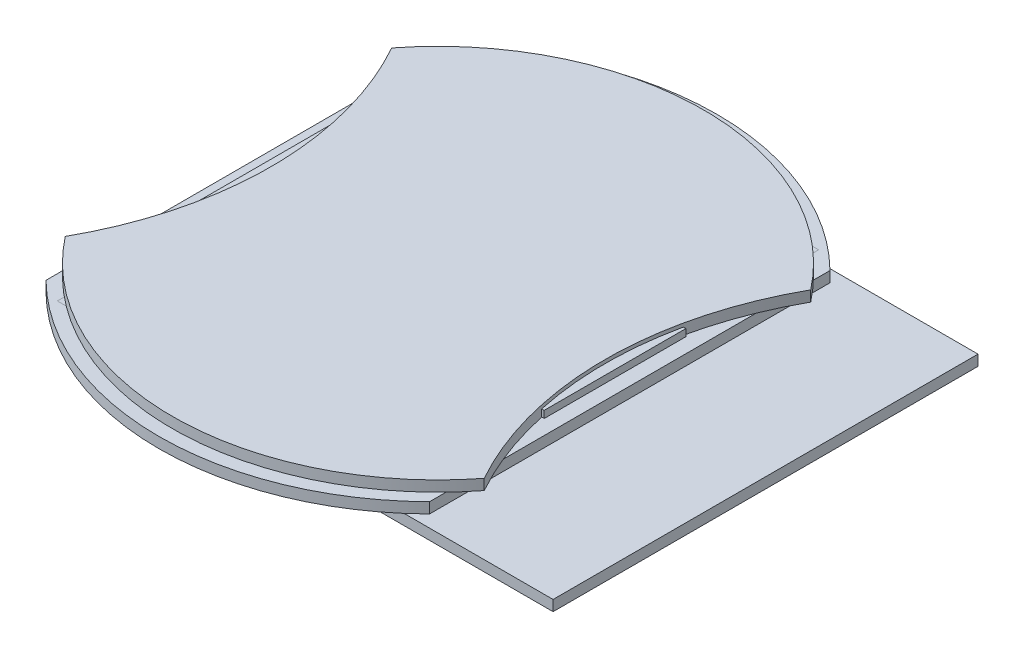
from build123d import *

# Parameters (mm, degrees)
SKETCH1_W                   = 140
SKETCH1_H                   = 120
COMPACT_DEPTH               = 3
SKETCH4_W                   = 95
SKETCH4_H                   = 120
SUPERCOMPACT_DEPTH          = 3
SKETCH7_R                   = 75
APPLE_BASE_DEPTH            = 3
SIDECUTS_DEPTH              = 195.694632694
APPLE_BASE_2_DEPTH          = 3
BOSS_EXTRUDE4_DEPTH         = 3
BASE_PLATE_FILLET_R         = 0.001
TOP_BOTTOM_EXTENSIONS_DEPTH = 3
SKETCH35_R                  = 1.25
SPACERHOLES_DEPTH           = 10
CUT_EXTRUDE4_DEPTH          = 10
SKETCH39_R                  = 1.5
CUT_EXTRUDE5_DEPTH          = 10
CUT_EXTRUDE6_START          = -3
CUT_EXTRUDE6_OUTLINE_R      = 1.5
CUT_EXTRUDE6_DEPTH          = 3
SKETCH41_R                  = 1.5
CUT_EXTRUDE7_DEPTH          = 10
SKETCH45_R                  = 1.5
CUT_EXTRUDE8_DEPTH          = 10
SKETCH46_R                  = 1.493508908
SKETCH46_R_2                = 1.5
SKETCH46_R_3                = 1.476707346
BOSS_EXTRUDE5_DEPTH         = 2


# Read off the part's stored shape, not the designer's step: Cut-Extrude6
with BuildPart() as part:
    # Sketch1 → Compact (new body)
    with BuildSketch(Plane(origin=(0, 0, 0), x_dir=(1, 0, 0), z_dir=(0, 1, 0))):
        with Locations((70, 60)):
            Rectangle(SKETCH1_W, SKETCH1_H)
    extrude(amount=COMPACT_DEPTH)


with BuildPart() as body_2:
    # Sketch4 → SuperCompact (new body)
    with BuildSketch(Plane(origin=(0, 3, 0), x_dir=(1, 0, 0), z_dir=(0, 1, 0))):
        with Locations((47.5, 60)):
            Rectangle(SKETCH4_W, SKETCH4_H)
    extrude(amount=SUPERCOMPACT_DEPTH)


with BuildPart() as body_3:
    # Sketch7 → Apple Base (new body)
    with BuildSketch(Plane(origin=(0, 6, 0), x_dir=(1, 0, 0), z_dir=(0, 1, 0))):
        with Locations(Location((47.5, 60, 0), (0, 0, 270))):
            Circle(SKETCH7_R)
    extrude(amount=APPLE_BASE_DEPTH)

    # Sketch8 → SideCuts (cut, through all)
    with BuildSketch(Plane(origin=(0, 9, 0), x_dir=(1, 0, 0), z_dir=(0, 1, 0))):
        with BuildLine():
            ThreePointArc((-11.66, 106.098746187), (0.350007958, 60), (-11.66, 13.901253813))
            ThreePointArc((-11.66, 13.901253813), (-27.5, 60), (-11.66, 106.098746187))
        make_face()
        with BuildLine():
            ThreePointArc((106.66, 106.098746187), (94.649992042, 60), (106.66, 13.901253813))
            ThreePointArc((106.66, 13.901253813), (122.5, 60), (106.66, 106.098746187))
        make_face()
    extrude(amount=-SIDECUTS_DEPTH, mode=Mode.SUBTRACT)


with BuildPart() as body_4:
    # Sketch9 → Apple_Base 2 (new body)
    with BuildSketch(Plane.XZ.offset(-6)):
        with BuildLine():
            ThreePointArc((106.66, -13.901253813), (47.5, 15), (-11.66, -13.901253813))
            ThreePointArc((-11.66, -13.901253813), (0.350007958, -60), (-11.66, -106.098746187))
            ThreePointArc((-11.66, -106.098746187), (47.5, -135), (106.66, -106.098746187))
            ThreePointArc((106.66, -106.098746187), (94.649992042, -60), (106.66, -13.901253813))
        make_face()
    extrude(amount=APPLE_BASE_2_DEPTH)

    # Sketch10 → Boss-Extrude4 (add)
    with BuildSketch(Plane(origin=(0, 6, 0), x_dir=(1, 0, 0), z_dir=(0, 1, 0))):
        with BuildLine():
            Line((-11.66, 106.098746187), (-11.66, 13.901253813))
            ThreePointArc((-11.66, 13.901253813), (0.350007958, 60), (-11.66, 106.098746187))
        make_face()
        with BuildLine():
            Line((106.66, 106.098746187), (106.66, 13.901253813))
            ThreePointArc((106.66, 13.901253813), (94.649992042, 60), (106.66, 106.098746187))
        make_face()
    extrude(amount=-BOSS_EXTRUDE4_DEPTH)

    # Base_Plate_Fillet
    base_plate_fillet_edges = [body_4.edges().sort_by_distance(p)[0] for p in [
        (-11.66, 3, -60),
        (-11.66, 6, -60),
        (47.5, 3, -135),
        (106.66, 3, -60),
        (106.66, 6, -60),
        (47.5, 6, -135),
        (47.5, 6, 15),
        (106.66, 4.5, -106.098746187),
        (-11.66, 4.5, -106.098746187),
        (-11.66, 4.5, -13.901253813),
        (106.66, 4.5, -13.901253813),
        (47.5, 3, 15),
    ]]
    fillet(base_plate_fillet_edges, radius=BASE_PLATE_FILLET_R)

    # Sketch25 → Top Bottom extensions (add)
    with BuildSketch(Plane(origin=(0, 6, 0), x_dir=(1, 0, 0), z_dir=(0, 1, 0))):
        with BuildLine():
            Line((-11.659005821, 106.097402592), (-11.659005821, 111.097402592))
            ThreePointArc((-11.659005821, 111.097402592), (47.5, 138.794628322), (106.659005821, 111.097402592))
            Line((106.659005821, 111.097402592), (106.659005821, 106.097402592))
            ThreePointArc((106.659005821, 106.097402592), (47.5, 133.794628322), (-11.659005821, 106.097402592))
        make_face()
        with BuildLine():
            Line((106.659005821, 13.902597408), (106.659005821, 8.902597408))
            ThreePointArc((106.659005821, 8.902597408), (47.5, -18.794628322), (-11.659005821, 8.902597408))
            Line((-11.659005821, 8.902597408), (-11.659005821, 13.902597408))
            ThreePointArc((-11.659005821, 13.902597408), (47.5, -13.794628322), (106.659005821, 13.902597408))
        make_face()
    extrude(amount=-TOP_BOTTOM_EXTENSIONS_DEPTH)

    # Sketch35 → SpacerHoles (cut)
    with BuildSketch(Plane.XZ.offset(-3)):
        with Locations(Location((7.5, -5.15, 0), (0, 0, 270))):
            Circle(SKETCH35_R)
        with Locations(Location((87.5, -5.15, 0), (0, 0, 270))):
            Circle(SKETCH35_R)
        with Locations(Location((87.5, -114.85, 0), (0, 0, 270))):
            Circle(SKETCH35_R)
        with Locations(Location((7.5, -114.85, 0), (0, 0, 270))):
            Circle(SKETCH35_R)
    extrude(amount=-SPACERHOLES_DEPTH, mode=Mode.SUBTRACT)

    # Sketch38 → Cut-Extrude4 (cut)
    with BuildSketch(Plane.XZ.offset(-3)):
        Polygon((47.5, 37.050137759), (120.372278362, 37.050137759), (120.372278362, -158.601845129), (-29.177494987, -158.601845129), (-29.177494987, 37.050137759), align=None)
        Polygon((-6.659, -60), (-6.659, 24.702355976), (101.659, 24.702355976), (101.659, -143.843523469), (-6.659, -143.843523469), align=None, mode=Mode.SUBTRACT)
    extrude(amount=-CUT_EXTRUDE4_DEPTH, mode=Mode.SUBTRACT)

    # Sketch39 → Cut-Extrude5 (cut)
    with BuildSketch(Plane.XZ.offset(-3)):
        with Locations(Location((7.5, -104.85, 0), (0, 0, 270))):
            Circle(SKETCH39_R)
        with Locations(Location((87.5, -104.85, 0), (0, 0, 270))):
            Circle(SKETCH39_R)
    extrude(amount=-CUT_EXTRUDE5_DEPTH, mode=Mode.SUBTRACT)

    # Cut-Extrude6 outline → Cut-Extrude6 (cut)
    with BuildSketch(Plane.XZ.offset(-3).offset(CUT_EXTRUDE6_START)):
        with Locations((15, -0.15)):
            Circle(CUT_EXTRUDE6_OUTLINE_R)
        with Locations((15, -119.85)):
            Circle(CUT_EXTRUDE6_OUTLINE_R)
        with Locations((80, -119.537367713)):
            Circle(CUT_EXTRUDE6_OUTLINE_R)
        with Locations((80, -89.037367713)):
            Circle(CUT_EXTRUDE6_OUTLINE_R)
        with Locations((80, -0.462632287)):
            Circle(CUT_EXTRUDE6_OUTLINE_R)
        with Locations((15, -30.65)):
            Circle(CUT_EXTRUDE6_OUTLINE_R)
        with Locations((80, -30.962632287)):
            Circle(CUT_EXTRUDE6_OUTLINE_R)
        with Locations((15, -89.35)):
            Circle(CUT_EXTRUDE6_OUTLINE_R)
    extrude(amount=CUT_EXTRUDE6_DEPTH, mode=Mode.SUBTRACT)

    # Sketch41 → Cut-Extrude7 (cut)
    with BuildSketch(Plane.XZ.offset(-3)):
        with Locations(Location((7.5, -15.15, 0), (0, 0, 270))):
            Circle(SKETCH41_R)
        with Locations(Location((87.459210086, -15.15, 0), (0, 0, 270))):
            Circle(SKETCH41_R)
    extrude(amount=-CUT_EXTRUDE7_DEPTH, mode=Mode.SUBTRACT)

    # Sketch45 → Cut-Extrude8 (cut)
    with BuildSketch(Plane(origin=(0, 6, 0), x_dir=(1, 0, 0), z_dir=(0, 1, 0))):
        with Locations(Location((77.5, 70, 0), (0, 0, 270))):
            Circle(SKETCH45_R)
        with Locations(Location((17.5, 70, 0), (0, 0, 270))):
            Circle(SKETCH45_R)
        with Locations(Location((17.5, 50, 0), (0, 0, 270))):
            Circle(SKETCH45_R)
        with Locations(Location((77.5, 50, 0), (0, 0, 270))):
            Circle(SKETCH45_R)
    extrude(amount=-CUT_EXTRUDE8_DEPTH, mode=Mode.SUBTRACT)

    # Sketch46 → Boss-Extrude5 (add)
    with BuildSketch(Plane(origin=(0, 6, 0), x_dir=(1, 0, 0), z_dir=(0, 1, 0))):
        Polygon((47.5, 80), (97.5, 80), (97.5, 40), (-2.5, 40), (-2.5, 80), align=None)
        with Locations(Location((17.5, 70, 0), (0, 0, 270))):
            Circle(SKETCH46_R, mode=Mode.SUBTRACT)
        with Locations(Location((77.5, 70, 0), (0, 0, 270))):
            Circle(SKETCH46_R_2, mode=Mode.SUBTRACT)
        with Locations(Location((77.5, 50, 0), (0, 0, 270))):
            Circle(SKETCH46_R_3, mode=Mode.SUBTRACT)
        with Locations(Location((17.5, 50, 0), (0, 0, 270))):
            Circle(SKETCH46_R_2, mode=Mode.SUBTRACT)
    extrude(amount=BOSS_EXTRUDE5_DEPTH)


solid = Compound([part.part, body_2.part, body_3.part, body_4.part])
